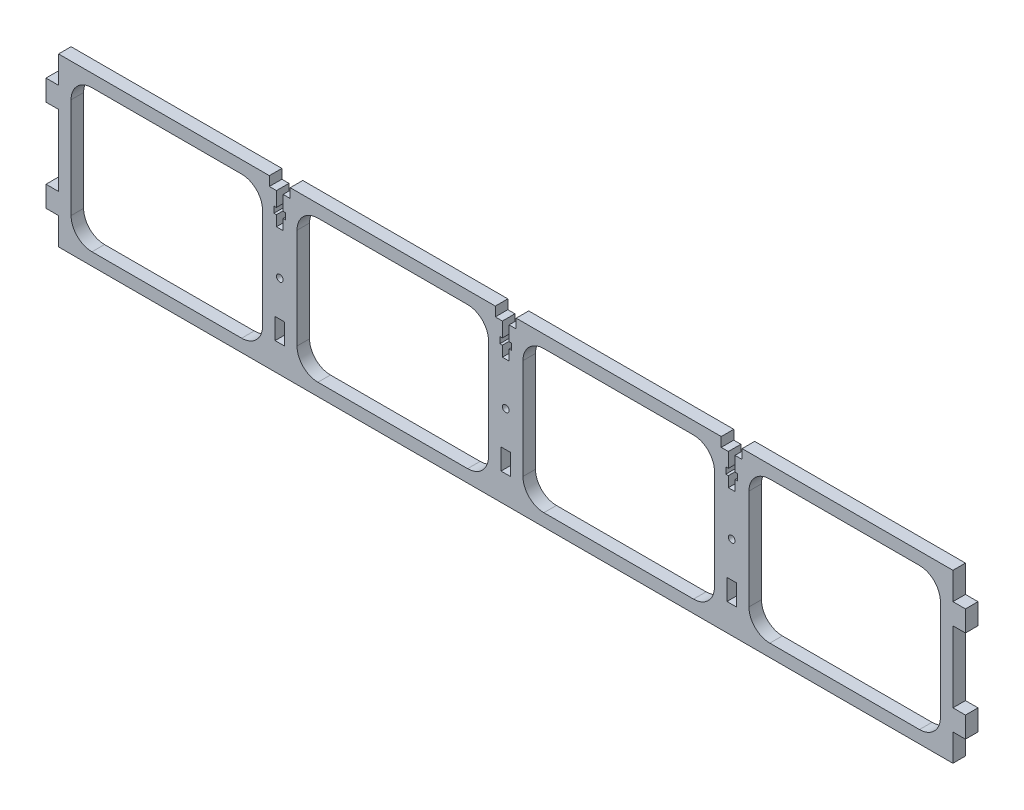
from build123d import *

# Parameters (mm, degrees)
SKETCH1_W           = 428
SKETCH1_H           = 80
BOSS_EXTRUDE1_DEPTH = 6
CUT_EXTRUDE1_REACH  = 219.789
LPATTERN1_COUNT     = 4
LPATTERN1_PITCH     = 108.125
SKETCH3_R           = 1.6
SKETCH3_W           = 4.5
SKETCH3_H           = 10
CUT_EXTRUDE2_DEPTH  = 218.788888605
SKETCH4_W           = 6
SKETCH4_H           = 10
BOSS_EXTRUDE2_DEPTH = 6
SKETCH5_W           = 10
SKETCH5_H           = 6
CUT_EXTRUDE3_DEPTH  = 4.5
CUT_EXTRUDE4_REACH  = 225.687


with BuildPart() as part:
    # Sketch1 → Boss-Extrude1 (new body)
    with BuildSketch(Plane.XY):
        Rectangle(SKETCH1_W, SKETCH1_H)
    extrude(amount=BOSS_EXTRUDE1_DEPTH)

    # Sketch2 → Cut-Extrude1 (cut, up to next)
    with BuildSketch(Plane.XY.offset(6), mode=Mode.PRIVATE) as cut_extrude1_sk1:
        with BuildLine():
            ThreePointArc((-126.375, -34), (-119.303932188, -31.071067812), (-116.375, -24))
            Line((-116.375, -24), (-116.375, 24))
            ThreePointArc((-116.375, 24), (-119.303932188, 31.071067812), (-126.375, 34))
            Line((-126.375, 34), (-198, 34))
            ThreePointArc((-198, 34), (-205.071067812, 31.071067812), (-208, 24))
            Line((-208, 24), (-208, -24))
            ThreePointArc((-208, -24), (-205.071067812, -31.071067812), (-198, -34))
            Line((-198, -34), (-126.375, -34))
        make_face()
    cut_extrude1_tool1 = extrude(cut_extrude1_sk1.sketch, amount=-CUT_EXTRUDE1_REACH, mode=Mode.PRIVATE) & part.part
    cut_extrude1 = cut_extrude1_tool1.solids().sort_by_distance((-162.1875, 0, 6))[0]
    add(cut_extrude1, mode=Mode.SUBTRACT)

    # LPattern1: Cut-Extrude1 ×4
    with Locations(*[(i * LPATTERN1_PITCH, 0, 0) for i in range(1, LPATTERN1_COUNT)]):
        add(cut_extrude1, mode=Mode.SUBTRACT)

    # Sketch3 → Cut-Extrude2 (cut, through all)
    with BuildSketch(Plane(origin=(0, 0, 0), x_dir=(-1, 0, 0), z_dir=(0, 0, -1))):
        with Locations((108.125, 0)):
            Circle(SKETCH3_R)
        Circle(SKETCH3_R)
        with Locations((-108.125, 0)):
            Circle(SKETCH3_R)
        with Locations((-108.125, -22)):
            Rectangle(SKETCH3_W, SKETCH3_H)
        with Locations((0, -22)):
            Rectangle(SKETCH3_W, SKETCH3_H)
        with Locations((108.125, -22)):
            Rectangle(SKETCH3_W, SKETCH3_H)
    extrude(amount=-CUT_EXTRUDE2_DEPTH, mode=Mode.SUBTRACT)

    # Sketch4 → Boss-Extrude2 (add)
    with BuildSketch(Plane(origin=(0, 0, 0), x_dir=(-1, 0, 0), z_dir=(0, 0, -1))):
        with Locations((-217, 22)):
            Rectangle(SKETCH4_W, SKETCH4_H)
        with Locations((-217, -22)):
            Rectangle(SKETCH4_W, SKETCH4_H)
        with Locations((217, -22)):
            Rectangle(SKETCH4_W, SKETCH4_H)
        with Locations((217, 22)):
            Rectangle(SKETCH4_W, SKETCH4_H)
    extrude(amount=-BOSS_EXTRUDE2_DEPTH)

    # Sketch5 → Cut-Extrude3 (cut)
    with BuildSketch(Plane(origin=(0, 40, 0), x_dir=(1, 0, 0), z_dir=(0, 1, 0))):
        with Locations((-108.125, -3)):
            Rectangle(SKETCH5_W, SKETCH5_H)
        with Locations((0, -3)):
            Rectangle(SKETCH5_W, SKETCH5_H)
        with Locations((108.125, -3)):
            Rectangle(SKETCH5_W, SKETCH5_H)
    extrude(amount=-CUT_EXTRUDE3_DEPTH, mode=Mode.SUBTRACT)

    # Sketch6 → Cut-Extrude4 (cut, up to next)
    with BuildSketch(Plane(origin=(0, 0, 0), x_dir=(-1, 0, 0), z_dir=(0, 0, -1)), mode=Mode.PRIVATE) as cut_extrude4_sk1:
        Polygon((-109.725, 35.5), (-109.725, 28.5), (-110.925, 28.5), (-110.925, 25.5), (-109.725, 25.5), (-109.725, 20.5), (-106.525, 20.5), (-106.525, 25.5), (-105.325, 25.5), (-105.325, 28.5), (-106.525, 28.5), (-106.525, 35.5), align=None)
    cut_extrude4_tool1 = extrude(cut_extrude4_sk1.sketch, amount=-CUT_EXTRUDE4_REACH, mode=Mode.PRIVATE) & part.part
    # Sketch6 → Cut-Extrude4 (cut, up to next)
    with BuildSketch(Plane(origin=(0, 0, 0), x_dir=(-1, 0, 0), z_dir=(0, 0, -1)), mode=Mode.PRIVATE) as cut_extrude4_sk2:
        Polygon((-1.595, 28.5), (-2.795, 28.5), (-2.795, 25.5), (-1.595, 25.5), (-1.595, 20.5), (1.605, 20.5), (1.605, 25.5), (2.805, 25.5), (2.805, 28.5), (1.605, 28.5), (1.605, 35.5), (-1.595, 35.5), align=None)
    cut_extrude4_tool2 = extrude(cut_extrude4_sk2.sketch, amount=-CUT_EXTRUDE4_REACH, mode=Mode.PRIVATE) & part.part
    # Sketch6 → Cut-Extrude4 (cut, up to next)
    with BuildSketch(Plane(origin=(0, 0, 0), x_dir=(-1, 0, 0), z_dir=(0, 0, -1)), mode=Mode.PRIVATE) as cut_extrude4_sk3:
        Polygon((106.535, 35.5), (106.535, 28.5), (105.335, 28.5), (105.335, 25.5), (106.535, 25.5), (106.535, 20.5), (109.735, 20.5), (109.735, 25.5), (110.935, 25.5), (110.935, 28.5), (109.735, 28.5), (109.735, 35.5), align=None)
    cut_extrude4_tool3 = extrude(cut_extrude4_sk3.sketch, amount=-CUT_EXTRUDE4_REACH, mode=Mode.PRIVATE) & part.part
    add(cut_extrude4_tool1.solids().sort_by_distance((108.125, 27.869565, 0))[0], mode=Mode.SUBTRACT)
    add(cut_extrude4_tool2.solids().sort_by_distance((-0.005, 27.869565, 0))[0], mode=Mode.SUBTRACT)
    add(cut_extrude4_tool3.solids().sort_by_distance((-108.135, 27.869565, 0))[0], mode=Mode.SUBTRACT)


solid = part.part
